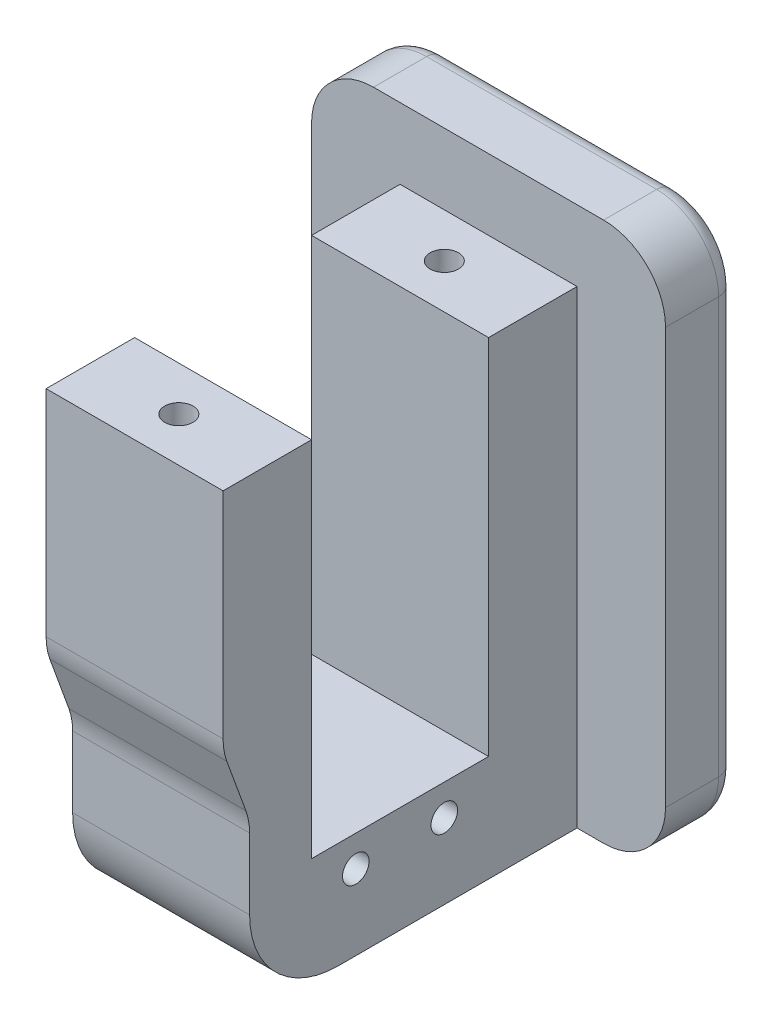
from build123d import *

# Parameters (mm, degrees)
BOSS_EXTRUDE1_DEPTH  = 8
CUT_EXTRUDE3_DEPTH   = 3
BOSS_EXTRUDE4_START  = 9
SKETCH10_R           = 9.75
BOSS_EXTRUDE4_DEPTH  = 9
BOSS_EXTRUDE5_DEPTH  = 10
SKETCH13_R           = 1.5
CUT_EXTRUDE4_DEPTH   = 10
SKETCH14_R           = 12
BOSS_EXTRUDE6_DEPTH  = 1
FILLET4_R            = 10
FILLET5_R            = 7
SKETCH15_OUTSIDE_W   = 85.02
SKETCH15_OUTSIDE_H   = 105.02
SKETCH15_OUTSIDE_W_2 = 40
SKETCH15_OUTSIDE_H_2 = 61
CUT_EXTRUDE5_DEPTH   = 129.593694432
FILLET6_R            = 7
SKETCH16_R           = 1.6
CUT_EXTRUDE6_DEPTH   = 15
FILLET7_R            = 2


with BuildPart() as part:
    # Sketch3 → Boss-Extrude1 (new body)
    with BuildSketch(Plane(origin=(0, 0, 30), x_dir=(-1, 0, 0), z_dir=(0, 0, -1))):
        with BuildLine():
            Line((55, 53.257283518), (105, 53.257283518))
            ThreePointArc((105, 53.257283518), (108.535533906, 51.792817424), (110, 48.257283518))
            Line((110, 48.257283518), (110, -21.742716482))
            ThreePointArc((110, -21.742716482), (108.535533906, -25.278250388), (105, -26.742716482))
            Line((105, -26.742716482), (55, -26.742716482))
            ThreePointArc((55, -26.742716482), (51.464466094, -25.278250388), (50, -21.742716482))
            Line((50, -21.742716482), (50, 48.257283518))
            ThreePointArc((50, 48.257283518), (51.464466094, 51.792817424), (55, 53.257283518))
        make_face()
    extrude(amount=BOSS_EXTRUDE1_DEPTH)

    # Sketch8 → Cut-Extrude3 (cut)
    with BuildSketch(Plane(origin=(0, 0, 22), x_dir=(-1, 0, 0), z_dir=(0, 0, -1))):
        with BuildLine():
            Line((78.25, 15.378603862), (78.25, 11.135963175))
            ThreePointArc((78.25, 11.135963175), (80, 10.507283518), (81.75, 11.135963175))
            Line((81.75, 11.135963175), (81.75, 15.378603862))
            ThreePointArc((81.75, 15.378603862), (80, 16.007283518), (78.25, 15.378603862))
        make_face()
    extrude(amount=-CUT_EXTRUDE3_DEPTH, mode=Mode.SUBTRACT)

    # Sketch10 → Boss-Extrude4 (add)
    with BuildSketch(Plane(origin=(0, 0, 22), x_dir=(-1, 0, 0), z_dir=(0, 0, -1)).offset(BOSS_EXTRUDE4_START)):
        with Locations((80, 13.257283518)):
            Circle(SKETCH10_R)
        with BuildLine():
            Line((81.75, 11.135963175), (81.75, 15.378603862))
            ThreePointArc((81.75, 15.378603862), (80, 16.007283518), (78.25, 15.378603862))
            Line((78.25, 15.378603862), (78.25, 11.135963175))
            ThreePointArc((78.25, 11.135963175), (80, 10.507283518), (81.75, 11.135963175))
        make_face(mode=Mode.SUBTRACT)
    extrude(amount=-BOSS_EXTRUDE4_DEPTH)

    # Sketch12 → Boss-Extrude5 (add, symmetric)
    with BuildSketch(Plane.ZY.offset(80)):
        Polygon((30, -19.242716482), (30, 33.757283518), (40, 33.757283518), (40, -7.242716482), (60, -7.242716482), (60, 33.757283518), (70, 33.757283518), (70, 8.239359157), (67.001118517, 0), (67.001118517, -19.242716482), align=None)
    extrude(amount=BOSS_EXTRUDE5_DEPTH, both=True)

    # Sketch13 → Cut-Extrude4 (cut)
    with BuildSketch(Plane(origin=(-70, 0, 0), x_dir=(0, 0, -1), z_dir=(1, 0, 0))):
        with Locations((-55, -10.742716482)):
            Circle(SKETCH13_R)
        with Locations((-45, -10.742716482)):
            Circle(SKETCH13_R)
        with Locations((-55, 37.257283518)):
            Circle(SKETCH13_R)
        with Locations((-45, 37.257283518)):
            Circle(SKETCH13_R)
    extrude(amount=-CUT_EXTRUDE4_DEPTH, mode=Mode.SUBTRACT)

    # Sketch14 → Boss-Extrude6 (add)
    with BuildSketch(Plane(origin=(0, 0, 22), x_dir=(-1, 0, 0), z_dir=(0, 0, -1))):
        with Locations((80, 13.257283518)):
            Circle(SKETCH14_R)
    extrude(amount=BOSS_EXTRUDE6_DEPTH)

    # Fillet4
    fillet4_edges = [part.edges().sort_by_distance(p)[0] for p in [
        (-80, -19.242716482, 67.001118517),
    ]]
    fillet(fillet4_edges, radius=FILLET4_R)

    # Fillet5
    fillet5_edges = [part.edges().sort_by_distance(p)[0] for p in [
        (-80, 8.239359157, 70),
        (-80, 0, 67.001118517),
    ]]
    fillet(fillet5_edges, radius=FILLET5_R)

    # Sketch15 outside → Cut-Extrude5 (cut, through all)
    with BuildSketch(Plane.XY.offset(30)):
        with Locations((-80, 13.257)):
            Rectangle(SKETCH15_OUTSIDE_W, SKETCH15_OUTSIDE_H)
        with Locations((-80, 11.257283518)):
            Rectangle(SKETCH15_OUTSIDE_W_2, SKETCH15_OUTSIDE_H_2, mode=Mode.SUBTRACT)
    extrude(amount=-CUT_EXTRUDE5_DEPTH, mode=Mode.SUBTRACT)

    # Fillet6
    fillet6_edges = [part.edges().sort_by_distance(p)[0] for p in [
        (-60, -19.242716482, 26),
        (-100, -19.242716482, 26),
        (-100, 41.757283518, 26),
        (-60, 41.757283518, 26),
    ]]
    fillet(fillet6_edges, radius=FILLET6_R)

    # Sketch16 → Cut-Extrude6 (cut)
    with BuildSketch(Plane(origin=(0, 33.757283518, 0), x_dir=(1, 0, 0), z_dir=(0, 1, 0))):
        with Locations((-80, -65)):
            Circle(SKETCH16_R)
        with Locations((-80, -35)):
            Circle(SKETCH16_R)
    extrude(amount=-CUT_EXTRUDE6_DEPTH, mode=Mode.SUBTRACT)

    # Fillet7
    fillet7_edges = [part.edges().sort_by_distance(p)[0] for p in [
        (-62.050252532, 39.707030987, 22),
        (-80, 41.757283518, 22),
        (-97.949747468, 39.707030987, 22),
        (-100, 11.257283518, 22),
        (-97.949747468, -17.19246395, 22),
        (-80, -19.242716482, 22),
        (-62.050252532, -17.19246395, 22),
        (-60, 11.257283518, 22),
    ]]
    fillet(fillet7_edges, radius=FILLET7_R)


solid = part.part
